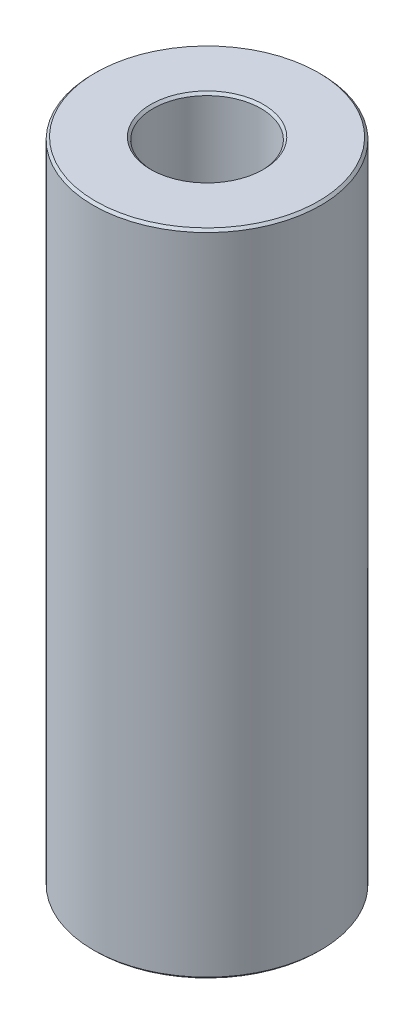
from build123d import *

# Parameters (mm, degrees)
SKETCH1_R           = 50
BOSS_EXTRUDE1_DEPTH = 285.437479087
SKETCH2_R           = 23.737029781
CUT_EXTRUDE1_DEPTH  = 295.065561512
CHAMFER1_SIZE       = 1.042278082


with BuildPart() as part:
    # Sketch1 → Boss-Extrude1 (new body)
    with BuildSketch(Plane(origin=(0, 0, 0), x_dir=(1, 0, 0), z_dir=(0, 1, 0))):
        Circle(SKETCH1_R)
    extrude(amount=BOSS_EXTRUDE1_DEPTH)

    # Sketch2 → Cut-Extrude1 (cut, through all)
    with BuildSketch(Plane(origin=(0, 0, 0), x_dir=(1, 0, 0), z_dir=(0, 1, 0))):
        Circle(SKETCH2_R)
    extrude(amount=CUT_EXTRUDE1_DEPTH, mode=Mode.SUBTRACT)

    # Chamfer1
    chamfer1_edges = [part.edges().sort_by_distance(p)[0] for p in [
        (-23.737029781, 285.437479087, 0),
        (-23.737029781, 0, 0),
        (-50, 0, 0),
        (-50, 285.437479087, 0),
    ]]
    chamfer(chamfer1_edges, length=CHAMFER1_SIZE)


solid = part.part
